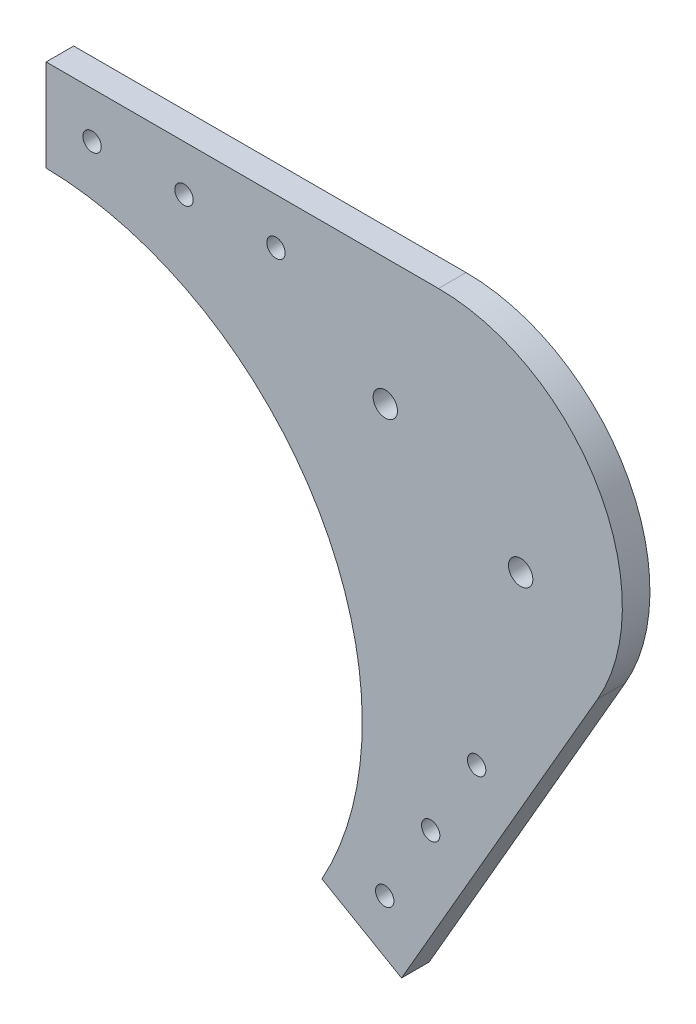
from build123d import *

# Parameters (mm, degrees)
EXTRUDE_1_DEPTH          = 6
FILLET_1_R               = 70
FILLET_2_R               = 40
CUT_EXTRUDE_1_DEPTH      = 170.497303225
CUT_EXTRUDE_1_DEPTH_BACK = 170.497303225
SKETCH_2_R               = 2.65
SKETCH_3_R               = 2
CUT_EXTRUDE_2_DEPTH      = 10


with BuildPart() as part:
    # 草图1 → 凸台-拉伸1 (new body)
    with BuildSketch(Plane.XY):
        Polygon((0, 0), (120, 0), (60, -103.923048454), (77.320508076, -113.923048454), (154.641016151, 20), (0, 20), align=None)
    extrude(amount=EXTRUDE_1_DEPTH)

    # 圆角1
    # the kernel refuses this fillet: 70 mm, written as the material it adds along each edge
    with BuildSketch(Plane(origin=(120, 0, 0), x_dir=(-1, 0, 0), z_dir=(0, 0, 1))) as fillet_1_piece_1:
        with BuildLine():
            CenterArc((121.224989992, 69.989280604), FILLET_1_R, 151.002719134, 117.994561732)
            Line((60, 103.923048454), (0, 0))
            Line((0, 0), (120, 0))
        make_face()
    extrude(amount=6)

    # 圆角2
    fillet_2_edges = [part.edges().sort_by_distance(p)[0] for p in [
        (154.641016151, 20, 3),
    ]]
    fillet(fillet_2_edges, radius=FILLET_2_R)

    # 草图2 → 切除-拉伸1 (cut, two sides: drawn at the far end of the back side and taken through both)
    with BuildSketch(Plane.XY.offset(6).offset(-CUT_EXTRUDE_1_DEPTH_BACK)):
        with Locations((103.232600298, -24.545834576)):
            Circle(SKETCH_2_R)
        with Locations((73.787736569, -7.545834576)):
            Circle(SKETCH_2_R)
    extrude(amount=CUT_EXTRUDE_1_DEPTH + CUT_EXTRUDE_1_DEPTH_BACK, mode=Mode.SUBTRACT)

    # 草图3 → 切除-拉伸2 (cut)
    with BuildSketch(Plane.XY.offset(6)):
        with Locations((10, 10)):
            Circle(SKETCH_3_R)
        with Locations((30, 10)):
            Circle(SKETCH_3_R)
        with Locations((50, 10)):
            Circle(SKETCH_3_R)
        with Locations((73.660254038, -100.262794416)):
            Circle(SKETCH_3_R)
        with Locations((83.660254038, -82.942286341)):
            Circle(SKETCH_3_R)
        with Locations((93.660254038, -65.621778265)):
            Circle(SKETCH_3_R)
    extrude(amount=-CUT_EXTRUDE_2_DEPTH, mode=Mode.SUBTRACT)


solid = part.part
